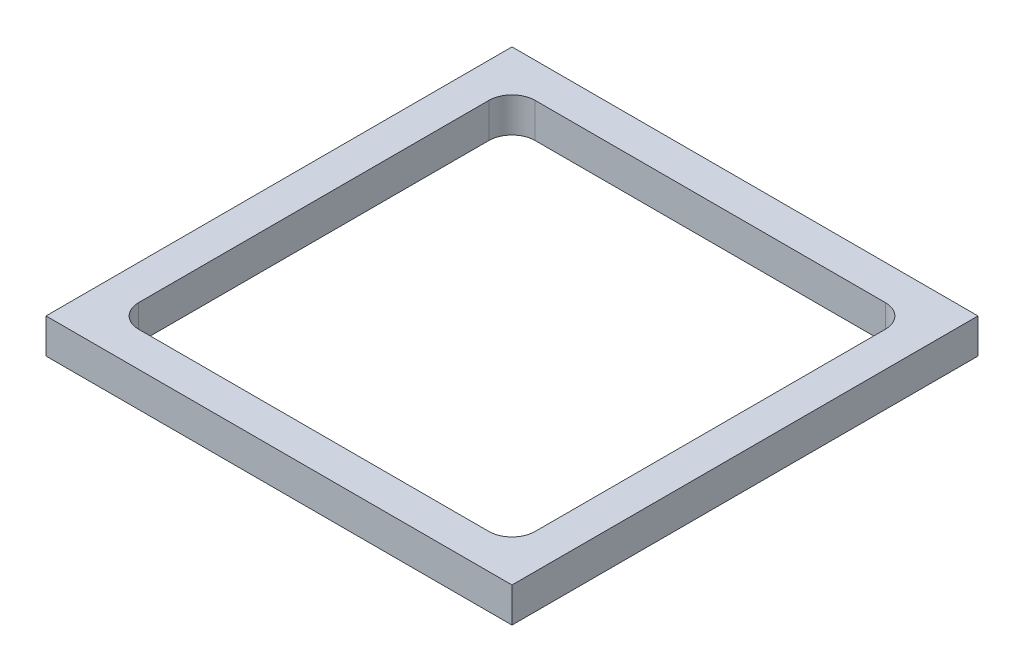
from build123d import *

# Parameters (mm, degrees)
SKETCH1_W           = 127.635
SKETCH1_H           = 127.635
BOSS_EXTRUDE1_DEPTH = 9.525
SKETCH5_W           = 108.585
SKETCH5_H           = 108.585
CUT_EXTRUDE1_DEPTH  = 9.525
FILLET1_R           = 6.35


with BuildPart() as part:
    # Sketch1 → Boss-Extrude1 (new body)
    with BuildSketch(Plane(origin=(0, 0, 0), x_dir=(1, 0, 0), z_dir=(0, 1, 0))):
        with Locations((63.8175, 63.8175)):
            Rectangle(SKETCH1_W, SKETCH1_H)
    extrude(amount=BOSS_EXTRUDE1_DEPTH)

    # Sketch5 → Cut-Extrude1 (cut)
    with BuildSketch(Plane(origin=(0, 9.525, 0), x_dir=(1, 0, 0), z_dir=(0, 1, 0))):
        with Locations((63.8175, 63.8175)):
            Rectangle(SKETCH5_W, SKETCH5_H)
    extrude(amount=-CUT_EXTRUDE1_DEPTH, mode=Mode.SUBTRACT)

    # Fillet1
    fillet1_edges = [part.edges().sort_by_distance(p)[0] for p in [
        (118.11, 4.7625, -9.525),
        (118.11, 4.7625, -118.11),
        (9.525, 4.7625, -118.11),
        (9.525, 4.7625, -9.525),
    ]]
    fillet(fillet1_edges, radius=FILLET1_R)


solid = part.part
